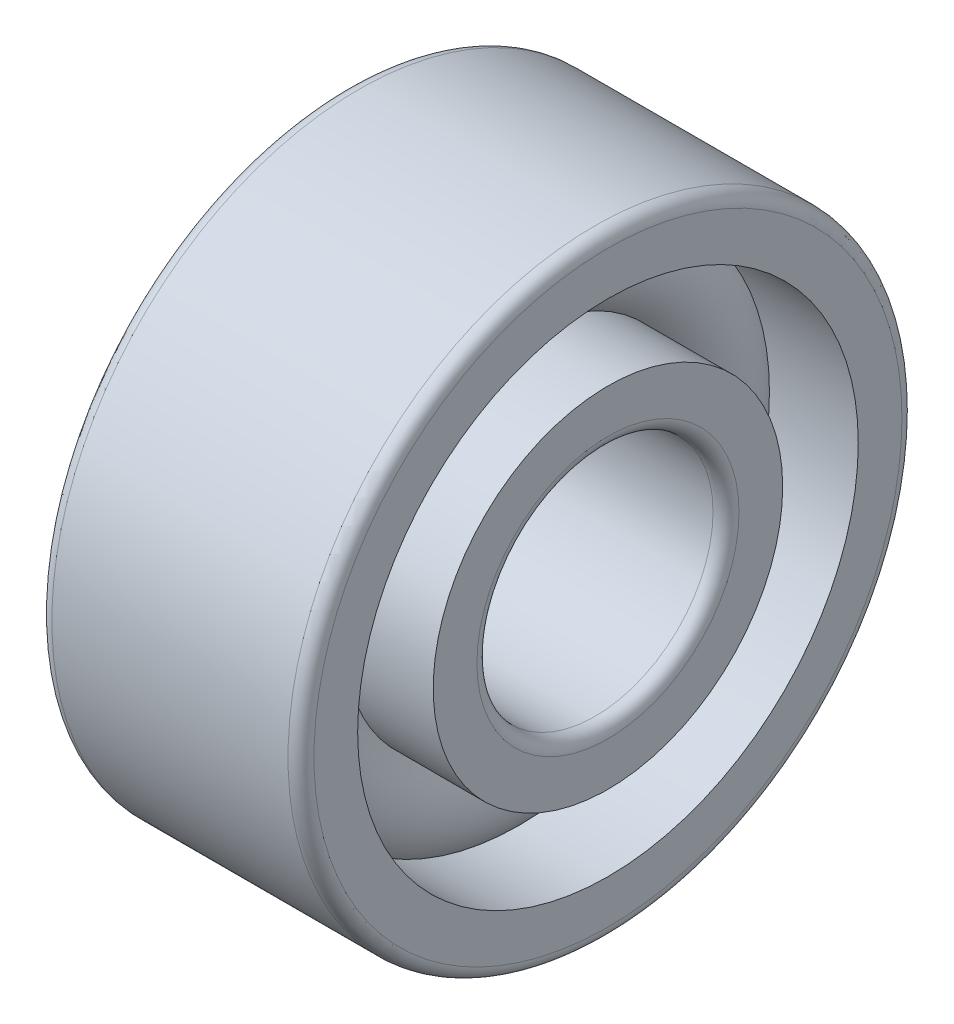
from build123d import *

# Parameters (mm, degrees)
CAGSPISKE_W     = 0.96
CAGSPISKE_H     = 1.6
CAGESPINE_ANGLE = 0.001
BALSIMSKE_R     = 4.8


with BuildPart() as part:
    # CagSpiSke → CageSpine (revolve)
    with BuildSketch(Plane.XY):
        with Locations((0, 18)):
            Rectangle(CAGSPISKE_W, CAGSPISKE_H)
    revolve(axis=Axis((-20.6375, 0, 0), (-1, 0, 0)), revolution_arc=CAGESPINE_ANGLE)

    # BalSimSke → BallsSimplified (revolve)
    with BuildSketch(Plane.XY):
        with Locations((0, 18)):
            Circle(BALSIMSKE_R)
    revolve(axis=Axis((-10, 0, 0), (1, 0, 0)))

    # InnRacSke → InnerRace (revolve)
    with BuildSketch(Plane.XY):
        with BuildLine():
            Line((-3.544097205, 14.8), (-11.1, 14.8))
            Line((-11.1, 14.8), (-11.1, 11.1))
            ThreePointArc((-11.1, 11.1), (-10.777817459, 10.322182541), (-10, 10))
            Line((-10, 10), (10, 10))
            ThreePointArc((10, 10), (10.777817459, 10.322182541), (11.1, 11.1))
            Line((11.1, 11.1), (11.1, 14.8))
            Line((11.1, 14.8), (3.544097205, 14.8))
            ThreePointArc((3.544097205, 14.8), (0, 13.225), (-3.544097205, 14.8))
        make_face()
    revolve(axis=Axis((-20.6375, 0, 0), (1, 0, 0)))

    # OutRacSke → OuterRace (revolve)
    with BuildSketch(Plane.XY):
        with BuildLine():
            Line((-3.544097205, 21.2), (-11.1, 21.2))
            Line((-11.1, 21.2), (-11.1, 24.9))
            ThreePointArc((-11.1, 24.9), (-10.777817459, 25.677817459), (-10, 26))
            Line((-10, 26), (10, 26))
            ThreePointArc((10, 26), (10.777817459, 25.677817459), (11.1, 24.9))
            Line((11.1, 24.9), (11.1, 21.2))
            Line((11.1, 21.2), (3.544097205, 21.2))
            ThreePointArc((3.544097205, 21.2), (0, 22.775), (-3.544097205, 21.2))
        make_face()
    revolve(axis=Axis((-20.6375, 0, 0), (1, 0, 0)))


solid = part.part
